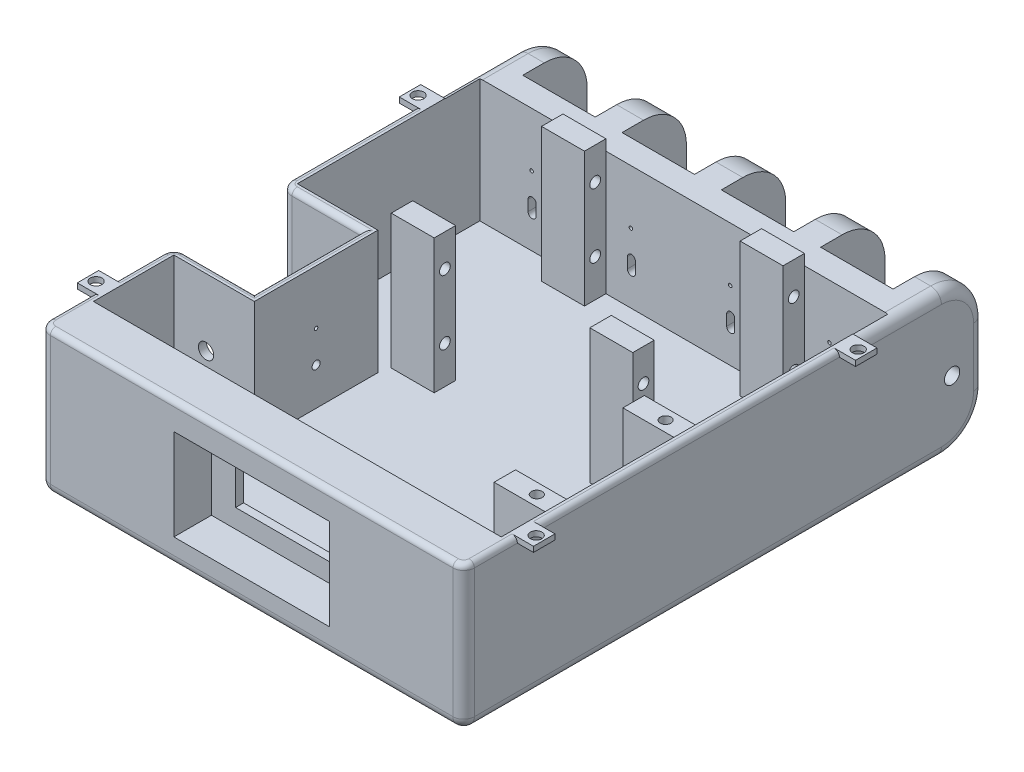
from build123d import *

# Parameters (mm, degrees)
BOSS_EXTRUDE1_DEPTH     = 27
CUT_EXTRUDE2_DEPTH      = 23
FILLET1_R               = 8
CUT_EXTRUDE4_DEPTH      = 10
LPATTERN2_COUNT         = 2
LPATTERN2_PITCH         = 2
LPATTERN2_COUNT_DIR2    = 4
LPATTERN2_PITCH_DIR2    = 18.5
SKETCH11_R              = 0.75
CUT_EXTRUDE5_DEPTH      = 2
SKETCH13_W              = 4
SKETCH13_H              = 1
BOSS_EXTRUDE4_DEPTH     = 3
SKETCH14_R              = 1.078343224
CUT_EXTRUDE6_DEPTH      = 125.49899598
LPATTERN3_COUNT         = 2
LPATTERN3_PITCH         = 60
LPATTERN3_COUNT_DIR2    = 2
LPATTERN3_PITCH_DIR2    = 82
LPATTERN4_COUNT         = 2
LPATTERN4_PITCH         = 60
LPATTERN4_COUNT_DIR2    = 2
LPATTERN4_PITCH_DIR2    = 82
CUT_EXTRUDE7_DEPTH      = 122.482509029
CUT_EXTRUDE7_DEPTH_BACK = 19
SKETCH3_R               = 1.425
CUT_EXTRUDE8_DEPTH      = 25
CUT_EXTRUDE8_DEPTH_BACK = 5
SKETCH9_R               = 1.425
SKETCH15_R              = 0.325
CUT_EXTRUDE9_DEPTH      = 114.38099488
LPATTERN5_COUNT         = 4
LPATTERN5_PITCH         = 18.5
SKETCH16_R              = 0.325
CUT_EXTRUDE10_DEPTH     = 115.539294567
SKETCH20_W              = 79
SKETCH20_H              = 27
BOSS_EXTRUDE7_DEPTH     = 7
SKETCH21_W              = 29
SKETCH21_H              = 17
CUT_EXTRUDE13_DEPTH     = 7
CUT_EXTRUDE14_REACH     = 126.712
SKETCH24_W              = 20
SKETCH24_H              = 10
FILLET7_R               = 2
FILLET8_R               = 1
SKETCH28_W              = 8
SKETCH28_H              = 4
BOSS_EXTRUDE8_DEPTH     = 25
SKETCH30_R              = 1
CUT_EXTRUDE15_DEPTH     = 8
LPATTERN6_COUNT         = 4
LPATTERN6_PITCH         = 37
LPATTERN7_COUNT         = 2
LPATTERN7_PITCH         = 37
SKETCH32_W              = 12.5
SKETCH32_H              = 4
BOSS_EXTRUDE9_DEPTH     = 20
LPATTERN8_COUNT         = 2
LPATTERN8_PITCH         = 24
SKETCH33_R              = 1
CUT_EXTRUDE16_DEPTH     = 5
LPATTERN9_COUNT         = 2
LPATTERN9_PITCH         = 24


# Some blends are built 0.0001 mm under size
with BuildPart() as part:
    # Sketch2 → Boss-Extrude1 (new body)
    with BuildSketch(Plane(origin=(0, 0, 0), x_dir=(1, 0, 0), z_dir=(0, 1, 0))):
        Polygon((0, 0), (79, 0), (79, 90), (74, 90), (74, 78), (60.5, 78), (60.5, 90), (55.5, 90), (55.5, 78), (42, 78), (42, 90), (37, 90), (37, 78), (23.5, 78), (23.5, 90), (18.5, 90), (18.5, 78), (5, 78), (5, 90), (0, 90), (0, 38), (15, 38), (15, 18), (0, 18), align=None)
    extrude(amount=BOSS_EXTRUDE1_DEPTH)

    # Sketch4 → Cut-Extrude2 (cut)
    with BuildSketch(Plane(origin=(0, 27, 0), x_dir=(1, 0, 0), z_dir=(0, 1, 0))):
        Polygon((1.5, 73.5), (1.5, 39.5), (16.5, 39.5), (16.5, 16.5), (1.5, 16.5), (1.5, 1.5), (77.5, 1.5), (77.5, 73.5), align=None)
    extrude(amount=-CUT_EXTRUDE2_DEPTH, mode=Mode.SUBTRACT)

    # Fillet1
    fillet1_edges = [part.edges().sort_by_distance(p)[0] for p in [
        (76.5, 27, -90),
        (2.5, 0, -90),
        (21, 0, -90),
        (39.5, 0, -90),
        (58, 0, -90),
        (76.5, 0, -90),
        (58, 27, -90),
        (39.5, 27, -90),
        (21, 27, -90),
        (2.5, 27, -90),
    ]]
    fillet(fillet1_edges, radius=FILLET1_R)

    # Sketch10 → Cut-Extrude4 (cut)
    with BuildSketch(Plane.XY.offset(-73.5)):
        with BuildLine():
            Line((10.5, 10), (10.5, 11.979593835))
            ThreePointArc((10.5, 11.979593835), (11.25, 12.729593835), (12, 11.979593835))
            Line((12, 11.979593835), (12, 10))
            ThreePointArc((12, 10), (11.25, 9.25), (10.5, 10))
        make_face()
    cut_extrude4 = extrude(amount=-CUT_EXTRUDE4_DEPTH, mode=Mode.SUBTRACT)

    # LPattern2: Cut-Extrude4 2 × 4
    with Locations(*[(j * LPATTERN2_PITCH_DIR2, 0, i * LPATTERN2_PITCH) for i in range(LPATTERN2_COUNT) for j in range(LPATTERN2_COUNT_DIR2) if (i, j) != (0, 0)]):
        add(cut_extrude4, mode=Mode.SUBTRACT)

    # Sketch11 → Cut-Extrude5 (cut)
    with BuildSketch(Plane(origin=(16.5, 0, 0), x_dir=(0, 0, -1), z_dir=(1, 0, 0))):
        with Locations((28, 11)):
            Circle(SKETCH11_R)
    extrude(amount=-CUT_EXTRUDE5_DEPTH, mode=Mode.SUBTRACT)

    # Sketch13 → Boss-Extrude4 (add)
    with BuildSketch(Plane(origin=(79, 0, 0), x_dir=(0, 0, -1), z_dir=(1, 0, 0))):
        with Locations((5, 26.5)):
            Rectangle(SKETCH13_W, SKETCH13_H)
    boss_extrude4 = extrude(amount=BOSS_EXTRUDE4_DEPTH)

    # Sketch14 → Cut-Extrude6 (cut, through all)
    with BuildSketch(Plane(origin=(0, 26, 0), x_dir=(-1, 0, 0), z_dir=(0, -1, 0))):
        with Locations(Location((-80.5, 5, 0), (0, 0, 90))):
            Circle(SKETCH14_R)
    cut_extrude6 = extrude(amount=-CUT_EXTRUDE6_DEPTH, mode=Mode.SUBTRACT)

    # LPattern3: Boss-Extrude4 2 × 2
    with Locations(*[(-j * LPATTERN3_PITCH_DIR2, 0, -i * LPATTERN3_PITCH) for i in range(LPATTERN3_COUNT) for j in range(LPATTERN3_COUNT_DIR2) if (i, j) != (0, 0)]):
        add(boss_extrude4)

    # LPattern4: Cut-Extrude6 2 × 2
    with Locations(*[(-j * LPATTERN4_PITCH_DIR2, 0, -i * LPATTERN4_PITCH) for i in range(LPATTERN4_COUNT) for j in range(LPATTERN4_COUNT_DIR2) if (i, j) != (0, 0)]):
        add(cut_extrude6, mode=Mode.SUBTRACT)

    # Sketch3 → Cut-Extrude7 (cut, two sides: drawn at the far end of the back side and taken through both)
    with BuildSketch(Plane.ZY.offset(-74).offset(-CUT_EXTRUDE7_DEPTH_BACK)):
        with Locations((-84, 12.5)):
            Circle(SKETCH3_R)
    extrude(amount=CUT_EXTRUDE7_DEPTH + CUT_EXTRUDE7_DEPTH_BACK, mode=Mode.SUBTRACT)

    # Sketch9 → Cut-Extrude8 (cut, two sides: drawn at the far end of the back side and taken through both)
    with BuildSketch(Plane.XY.offset(-38).offset(-CUT_EXTRUDE8_DEPTH_BACK)):
        with Locations((7.5, 14.5)):
            Circle(SKETCH9_R)
    extrude(amount=CUT_EXTRUDE8_DEPTH + CUT_EXTRUDE8_DEPTH_BACK, mode=Mode.SUBTRACT)

    # Sketch15 → Cut-Extrude9 (cut, through all)
    with BuildSketch(Plane.XY.offset(-73.5)):
        with Locations((11.15, 16.9)):
            Circle(SKETCH15_R)
    cut_extrude9 = extrude(amount=-CUT_EXTRUDE9_DEPTH, mode=Mode.SUBTRACT)

    # LPattern5: Cut-Extrude9 ×4
    with Locations(*[(i * LPATTERN5_PITCH, 0, 0) for i in range(1, LPATTERN5_COUNT)]):
        add(cut_extrude9, mode=Mode.SUBTRACT)

    # Sketch16 → Cut-Extrude10 (cut, through all)
    with BuildSketch(Plane(origin=(16.5, 0, 0), x_dir=(0, 0, -1), z_dir=(1, 0, 0))):
        with Locations((28, 16.9)):
            Circle(SKETCH16_R)
    extrude(amount=-CUT_EXTRUDE10_DEPTH, mode=Mode.SUBTRACT)

    # Sketch20 → Boss-Extrude7 (add)
    with BuildSketch(Plane.XY):
        with Locations((39.5, 13.5)):
            Rectangle(SKETCH20_W, SKETCH20_H)
    extrude(amount=BOSS_EXTRUDE7_DEPTH)

    # Sketch21 → Cut-Extrude13 (cut)
    with BuildSketch(Plane.XY.offset(7)):
        with Locations((39.5, 13.5)):
            Rectangle(SKETCH21_W, SKETCH21_H)
    extrude(amount=-CUT_EXTRUDE13_DEPTH, mode=Mode.SUBTRACT)

    # Sketch24 → Cut-Extrude14 (cut, up to next)
    with BuildSketch(Plane.XY, mode=Mode.PRIVATE) as cut_extrude14_sk1:
        with Locations((39.5, 13.5)):
            Rectangle(SKETCH24_W, SKETCH24_H)
    cut_extrude14_tool1 = extrude(cut_extrude14_sk1.sketch, amount=-CUT_EXTRUDE14_REACH, mode=Mode.PRIVATE) & part.part
    add(cut_extrude14_tool1.solids().sort_by_distance((39.5, 13.5, 0))[0], mode=Mode.SUBTRACT)

    # Fillet7
    # the kernel refuses this fillet: 2 mm, written as the material it takes off along each edge
    with BuildSketch(Plane(origin=(77, 2, 5), x_dir=(0, -1, 0), z_dir=(1, 0, 0))) as fillet7_piece_1_section:
        Polygon((0, 0), (FILLET7_R * 1.02, 0), (FILLET7_R * 1.02, -FILLET7_R * 1.02), (0, -FILLET7_R * 1.02), align=None)
    fillet7_piece_1 = extrude(amount=FILLET7_R * 1.02, mode=Mode.PRIVATE)
    fillet7_piece_1 = fillet7_piece_1 - Plane(origin=(77, 2, 5), x_dir=(0, 0.7071067811865475, -0.7071067811865475), z_dir=(1, 0, 0)) * Sphere(FILLET7_R, mode=Mode.PRIVATE)
    add(fillet7_piece_1, mode=Mode.SUBTRACT)
    with BuildSketch(Plane(origin=(2, 2, 5), x_dir=(0, -1, 0), z_dir=(-1, 0, 0))) as fillet7_piece_2_section:
        Polygon((0, 0), (FILLET7_R * 1.02, 0), (FILLET7_R * 1.02, FILLET7_R * 1.02), (0, FILLET7_R * 1.02), align=None)
    fillet7_piece_2 = extrude(amount=FILLET7_R * 1.02, mode=Mode.PRIVATE)
    fillet7_piece_2 = fillet7_piece_2 - Plane(origin=(2, 2, 5), x_dir=(0, 0.7071067811865475, -0.7071067811865475), z_dir=(-1, 0, 0)) * Sphere(FILLET7_R, mode=Mode.PRIVATE)
    add(fillet7_piece_2, mode=Mode.SUBTRACT)
    with BuildSketch(Plane(origin=(2, 2, -40), x_dir=(-1, 0, 0), z_dir=(0, -1, 0))) as fillet7_piece_3_section:
        Polygon((0, 0), (FILLET7_R * 1.02, 0), (FILLET7_R * 1.02, -FILLET7_R * 1.02), (0, -FILLET7_R * 1.02), align=None)
    fillet7_piece_3 = extrude(amount=FILLET7_R * 1.02, mode=Mode.PRIVATE)
    fillet7_piece_3 = fillet7_piece_3 - Plane(origin=(2, 2, -40), x_dir=(0.7071067811865476, 0, -0.7071067811865475), z_dir=(0, -1, 0)) * Sphere(FILLET7_R, mode=Mode.PRIVATE)
    add(fillet7_piece_3, mode=Mode.SUBTRACT)
    with BuildSketch(Plane(origin=(0, 27, -82), x_dir=(1, 0, 0), z_dir=(0, 0, 1))) as fillet7_piece_4:
        with BuildLine():
            CenterArc((FILLET7_R, -FILLET7_R), FILLET7_R, 90, 90)
            Line((0, -FILLET7_R), (0, 0))
            Line((0, 0), (FILLET7_R, 0))
        make_face()
    extrude(amount=15, mode=Mode.SUBTRACT)
    with BuildSketch(Plane(origin=(79, 27, -67), x_dir=(0, -1, 0), z_dir=(0, 0, -1))) as fillet7_piece_5:
        with BuildLine():
            CenterArc((FILLET7_R, FILLET7_R), FILLET7_R, 180, 90)
            Line((0, FILLET7_R), (0, 0))
            Line((0, 0), (FILLET7_R, 0))
        make_face()
    extrude(amount=15, mode=Mode.SUBTRACT)
    with BuildSketch(Plane(origin=(79, 8, -82), x_dir=(0, -1, 0), z_dir=(0, 0, 1))) as fillet7_piece_6:
        with BuildLine():
            CenterArc((8 - FILLET7_R, -FILLET7_R), FILLET7_R, 0, 90)
            Line((8, -FILLET7_R), (8, 0))
            Line((8, 0), (8 - FILLET7_R, 0))
        make_face()
    revolve(axis=Axis((79, 8, -82), (1, 0, 0)), revolution_arc=90, mode=Mode.SUBTRACT)
    with BuildSketch(Plane(origin=(79, 8, -90), x_dir=(0, 0, 1), z_dir=(0, 1, 0))) as fillet7_piece_7:
        with BuildLine():
            CenterArc((FILLET7_R, -FILLET7_R), FILLET7_R, 90, 90)
            Line((0, -FILLET7_R), (0, 0))
            Line((0, 0), (FILLET7_R, 0))
        make_face()
    extrude(amount=11, mode=Mode.SUBTRACT)
    with BuildSketch(Plane(origin=(79, 19, -82), x_dir=(0, 1, 0), z_dir=(0, 0, 1))) as fillet7_piece_8:
        with BuildLine():
            CenterArc((8 - FILLET7_R, FILLET7_R), FILLET7_R, 270, 90)
            Line((8, FILLET7_R), (8, 0))
            Line((8, 0), (8 - FILLET7_R, 0))
        make_face()
    revolve(axis=Axis((79, 19, -82), (-1, 0, 0)), revolution_arc=90, mode=Mode.SUBTRACT)
    with BuildSketch(Plane(origin=(79, 0, 5), x_dir=(0, 1, 0), z_dir=(0, 0, -1))) as fillet7_piece_9:
        with BuildLine():
            CenterArc((FILLET7_R, -FILLET7_R), FILLET7_R, 90, 90)
            Line((0, -FILLET7_R), (0, 0))
            Line((0, 0), (FILLET7_R, 0))
        make_face()
    extrude(amount=87, mode=Mode.SUBTRACT)
    with BuildSketch(Plane(origin=(79, 32, 7), x_dir=(0, 0, -1), z_dir=(0, -1, 0)), Plane(origin=(0, 2, -38), x_dir=(0, 0, -1), z_dir=(0, 1, 0))) as fillet7_piece_10:
        with BuildLine():
            CenterArc((FILLET7_R, -FILLET7_R), FILLET7_R, 90, 90)
            Line((0, -FILLET7_R), (0, 0))
            Line((0, 0), (FILLET7_R, 0))
        make_face()
    extrude(amount=30, mode=Mode.SUBTRACT)
    with BuildSketch(Plane(origin=(77, 0, 7), x_dir=(0, 0, -1), z_dir=(-1, 0, 0))) as fillet7_piece_11:
        with BuildLine():
            CenterArc((FILLET7_R, -FILLET7_R), FILLET7_R, 90, 90)
            Line((0, -FILLET7_R), (0, 0))
            Line((0, 0), (FILLET7_R, 0))
        make_face()
    extrude(amount=75, mode=Mode.SUBTRACT)
    with BuildSketch(Plane(origin=(0, 2, 7), x_dir=(1, 0, 0), z_dir=(0, 1, 0))) as fillet7_piece_12:
        with BuildLine():
            CenterArc((FILLET7_R, FILLET7_R), FILLET7_R, 180, 90)
            Line((0, FILLET7_R), (0, 0))
            Line((0, 0), (FILLET7_R, 0))
        make_face()
    extrude(amount=30, mode=Mode.SUBTRACT)
    with BuildSketch(Plane(origin=(0, -5, -18), x_dir=(1, 0, 0), z_dir=(0, 1, 0))) as fillet7_piece_13:
        with BuildLine():
            CenterArc((FILLET7_R, -FILLET7_R), FILLET7_R, 90, 90)
            Line((0, -FILLET7_R), (0, 0))
            Line((0, 0), (FILLET7_R, 0))
        make_face()
    extrude(amount=37, mode=Mode.SUBTRACT)
    with BuildSketch(Plane(origin=(0, 0, 5), x_dir=(1, 0, 0), z_dir=(0, 0, -1))) as fillet7_piece_14:
        with BuildLine():
            CenterArc((FILLET7_R, -FILLET7_R), FILLET7_R, 90, 90)
            Line((0, -FILLET7_R), (0, 0))
            Line((0, 0), (FILLET7_R, 0))
        make_face()
    extrude(amount=28, mode=Mode.SUBTRACT)
    with BuildSketch(Plane(origin=(15, 0, -38), x_dir=(1, 0, 0), z_dir=(0, 0, 1))) as fillet7_piece_15:
        with BuildLine():
            CenterArc((FILLET7_R, FILLET7_R), FILLET7_R, 180, 90)
            Line((0, FILLET7_R), (0, 0))
            Line((0, 0), (FILLET7_R, 0))
        make_face()
    extrude(amount=20, mode=Mode.SUBTRACT)
    with BuildSketch(Plane(origin=(2, 0, -38), x_dir=(0, 0, -1), z_dir=(1, 0, 0))) as fillet7_piece_16:
        with BuildLine():
            CenterArc((FILLET7_R, FILLET7_R), FILLET7_R, 180, 90)
            Line((0, FILLET7_R), (0, 0))
            Line((0, 0), (FILLET7_R, 0))
        make_face()
    extrude(amount=13, mode=Mode.SUBTRACT)
    with BuildSketch(Plane(origin=(0, 0, -82), x_dir=(1, 0, 0), z_dir=(0, 0, 1))) as fillet7_piece_17:
        with BuildLine():
            CenterArc((FILLET7_R, FILLET7_R), FILLET7_R, 180, 90)
            Line((0, FILLET7_R), (0, 0))
            Line((0, 0), (FILLET7_R, 0))
        make_face()
    extrude(amount=42, mode=Mode.SUBTRACT)
    with BuildSketch(Plane(origin=(0, 8, -82), x_dir=(0, -1, 0), z_dir=(0, 0, 1))) as fillet7_piece_18:
        with BuildLine():
            CenterArc((8 - FILLET7_R, FILLET7_R), FILLET7_R, 270, 90)
            Line((8 - FILLET7_R, 0), (8, 0))
            Line((8, 0), (8, FILLET7_R))
        make_face()
    revolve(axis=Axis((0, 8, -82), (1, 0, 0)), revolution_arc=90, mode=Mode.SUBTRACT)
    with BuildSketch(Plane(origin=(0, 8, -90), x_dir=(0, 0, 1), z_dir=(0, 1, 0))) as fillet7_piece_19:
        with BuildLine():
            CenterArc((FILLET7_R, FILLET7_R), FILLET7_R, 180, 90)
            Line((0, FILLET7_R), (0, 0))
            Line((0, 0), (FILLET7_R, 0))
        make_face()
    extrude(amount=11, mode=Mode.SUBTRACT)
    with BuildSketch(Plane(origin=(0, 19, -82), x_dir=(0, 1, 0), z_dir=(0, 0, 1))) as fillet7_piece_20:
        with BuildLine():
            CenterArc((8 - FILLET7_R, -FILLET7_R), FILLET7_R, 360, 90)
            Line((8, -FILLET7_R), (8, 0))
            Line((8, 0), (8 - FILLET7_R, 0))
        make_face()
    revolve(axis=Axis((0, 19, -82), (-1, 0, 0)), revolution_arc=90, mode=Mode.SUBTRACT)
    with BuildSketch(Plane(origin=(2, 0, -38), x_dir=(0, 0, -1), z_dir=(1, 0, 0))) as fillet7_piece_21a_section:
        with BuildLine():
            CenterArc((FILLET7_R, FILLET7_R), FILLET7_R, 180, 90)
            Line((0, FILLET7_R), (0, 0))
            Line((0, 0), (FILLET7_R, 0))
        make_face()
    fillet7_piece_21a = extrude(amount=18, mode=Mode.PRIVATE)
    fillet7_piece_21a = split(fillet7_piece_21a, bisect_by=Plane(origin=(15, 0, -38), z_dir=(1, 0, 0)), keep=Keep.TOP, mode=Mode.PRIVATE)
    with BuildSketch(Plane(origin=(15, 0, -43), x_dir=(1, 0, 0), z_dir=(0, 0, 1))) as fillet7_piece_21b_section:
        with BuildLine():
            CenterArc((FILLET7_R, FILLET7_R), FILLET7_R, 180, 90)
            Line((0, FILLET7_R), (0, 0))
            Line((0, 0), (FILLET7_R, 0))
        make_face()
    fillet7_piece_21b = extrude(amount=25, mode=Mode.PRIVATE)
    fillet7_piece_21b = split(fillet7_piece_21b, bisect_by=Plane(origin=(15, 0, -38), z_dir=(0, 0, -1)), keep=Keep.TOP, mode=Mode.PRIVATE)
    fillet7_piece_21 = fillet7_piece_21a & fillet7_piece_21b
    add(fillet7_piece_21, mode=Mode.SUBTRACT)

    # Fillet8
    fillet8_edges = [part.edges().sort_by_distance(p)[0] for p in [
        (79, 27, -35),
        (0, 27, -51.5),
        (0, 27, 1),
        (79, 27, 1),
        (8.5, 27, -38),
        (0, 27, -11.5),
        (0.585786438, 27, -38.585786438),
        (0.585786438, 27, -17.414213562),
        (0.585786438, 27, 6.414213562),
        (78.414213562, 27, 6.414213562),
        (15, 27, -28),
        (8.5, 27, -18),
    ]]
    fillet(fillet8_edges, radius=FILLET8_R - 0.0001)  # a hair under: the kernel refuses the full size

    # Sketch28 → Boss-Extrude8 (add)
    with BuildSketch(Plane(origin=(0, 4, 0), x_dir=(1, 0, 0), z_dir=(0, 1, 0))):
        with Locations((21, 71.5)):
            Rectangle(SKETCH28_W, SKETCH28_H)
        with Locations((21, 43.5)):
            Rectangle(SKETCH28_W, SKETCH28_H)
    boss_extrude8 = extrude(amount=BOSS_EXTRUDE8_DEPTH)

    # Sketch30 → Cut-Extrude15 (cut)
    with BuildSketch(Plane(origin=(25, 0, 0), x_dir=(0, 0, -1), z_dir=(1, 0, 0))):
        with Locations((43.5, 11)):
            Circle(SKETCH30_R)
        with Locations((43.5, 23)):
            Circle(SKETCH30_R)
        with Locations((71.5, 11)):
            Circle(SKETCH30_R)
        with Locations((71.5, 23)):
            Circle(SKETCH30_R)
    cut_extrude15 = extrude(amount=-CUT_EXTRUDE15_DEPTH, mode=Mode.SUBTRACT)

    # LPattern6: Boss-Extrude8 ×4, 2 skipped
    with Locations(*[(i * LPATTERN6_PITCH, 0, 0) for i in range(1, LPATTERN6_COUNT) if i not in (2, 3)]):
        add(boss_extrude8)

    # LPattern7: Cut-Extrude15 ×2
    with Locations(*[(i * LPATTERN7_PITCH, 0, 0) for i in range(1, LPATTERN7_COUNT)]):
        add(cut_extrude15, mode=Mode.SUBTRACT)

    # Sketch32 → Boss-Extrude9 (add)
    with BuildSketch(Plane(origin=(0, 4, 0), x_dir=(1, 0, 0), z_dir=(0, 1, 0))):
        with Locations((71.25, 38.659093274)):
            Rectangle(SKETCH32_W, SKETCH32_H)
    boss_extrude9 = extrude(amount=BOSS_EXTRUDE9_DEPTH)

    # LPattern8: Boss-Extrude9 ×2
    with Locations(*[(0, 0, i * LPATTERN8_PITCH) for i in range(1, LPATTERN8_COUNT)]):
        add(boss_extrude9)

    # Sketch33 → Cut-Extrude16 (cut)
    with BuildSketch(Plane(origin=(0, 24, 0), x_dir=(1, 0, 0), z_dir=(0, 1, 0))):
        with Locations(Location((70.960241618, 38.659093274, 0), (0, 0, 270))):
            Circle(SKETCH33_R)
    cut_extrude16 = extrude(amount=-CUT_EXTRUDE16_DEPTH, mode=Mode.SUBTRACT)

    # LPattern9: Cut-Extrude16 ×2
    with Locations(*[(0, 0, i * LPATTERN9_PITCH) for i in range(1, LPATTERN9_COUNT)]):
        add(cut_extrude16, mode=Mode.SUBTRACT)


solid = part.part
